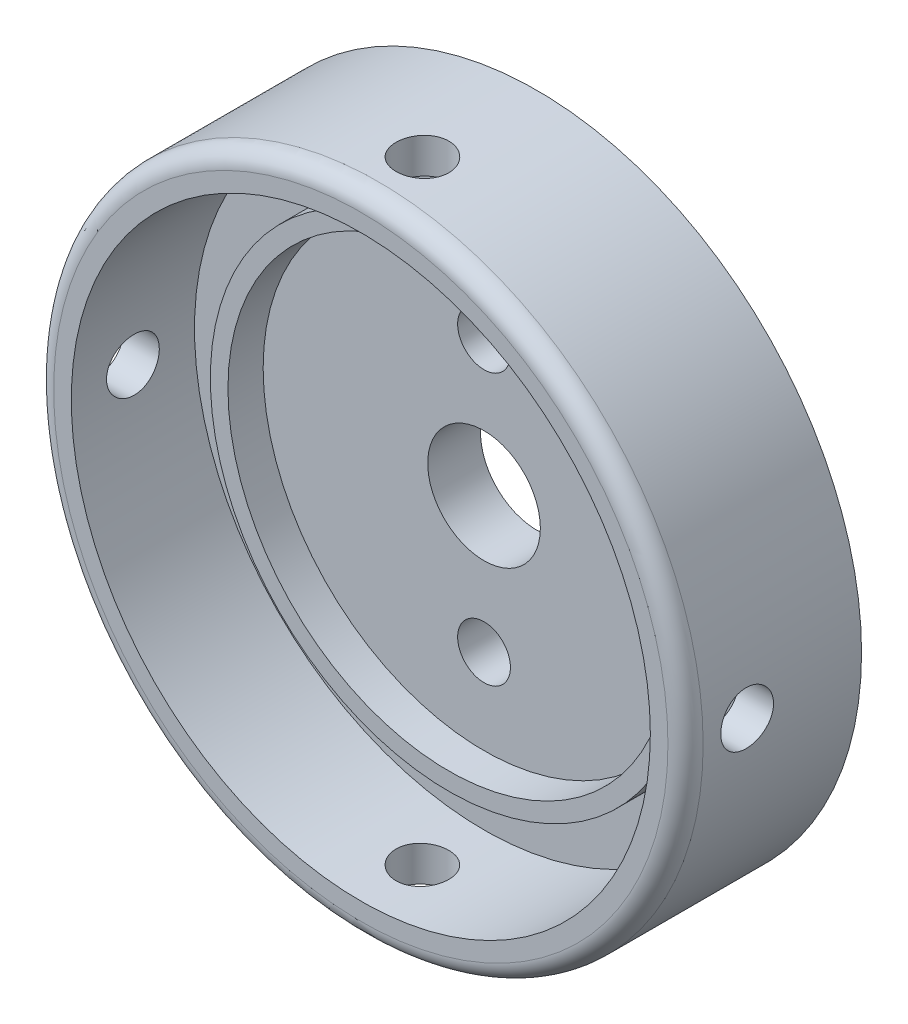
from build123d import *

# Parameters (mm, degrees)
ESQUISSE1_R                  = 18.45
ESQUISSE1_R_2                = 1.5
ESQUISSE1_R_3                = 3.2
BOSS_EXTRU_2_DEPTH           = 3
ESQUISSE1_13_R               = 18.45
ESQUISSE1_13_R_2             = 16.45
BOSS_EXTRU_4_DEPTH           = 10
ESQUISSE1_14_R               = 13.55
ESQUISSE1_14_R_2             = 12.55
BOSS_EXTRU_5_DEPTH           = 5
ENL_V_MAT_EXTRU_1_DEPTH      = 28.942888183
ENL_V_MAT_EXTRU_1_DEPTH_BACK = 28.942888183
ESQUISSE2_R                  = 1.5
ENL_V_MAT_EXTRU_2_DEPTH      = 28.942888353
ENL_V_MAT_EXTRU_2_DEPTH_BACK = 28.942888353
ESQUISSE3_R                  = 1.5
CONG_1_R                     = 1


with BuildPart() as part:
    # Esquisse1 → Boss.-Extru.2 (new body)
    with BuildSketch(Plane.XY):
        Circle(ESQUISSE1_R)
        with Locations((0, 7.7)):
            Circle(ESQUISSE1_R_2, mode=Mode.SUBTRACT)
        with Locations((0, -7.7)):
            Circle(ESQUISSE1_R_2, mode=Mode.SUBTRACT)
        Circle(ESQUISSE1_R_3, mode=Mode.SUBTRACT)
    extrude(amount=BOSS_EXTRU_2_DEPTH)

    # Esquisse1<13> → Boss.-Extru.4 (add)
    with BuildSketch(Plane.XY):
        Circle(ESQUISSE1_13_R)
        Circle(ESQUISSE1_13_R_2, mode=Mode.SUBTRACT)
    extrude(amount=BOSS_EXTRU_4_DEPTH)

    # Esquisse1<14> → Boss.-Extru.5 (add)
    with BuildSketch(Plane.XY):
        Circle(ESQUISSE1_14_R)
        Circle(ESQUISSE1_14_R_2, mode=Mode.SUBTRACT)
    extrude(amount=BOSS_EXTRU_5_DEPTH)

    # Esquisse2 → Enlèv. mat.-Extru.1 (cut, two sides: drawn at the far end of the back side and taken through both)
    with BuildSketch(Plane(origin=(0, 0, 0), x_dir=(0, 0, -1), z_dir=(1, 0, 0)).offset(-ENL_V_MAT_EXTRU_1_DEPTH_BACK)):
        with Locations((-6.5, 0)):
            Circle(ESQUISSE2_R)
    extrude(amount=ENL_V_MAT_EXTRU_1_DEPTH + ENL_V_MAT_EXTRU_1_DEPTH_BACK, mode=Mode.SUBTRACT)

    # Esquisse3 → Enlèv. mat.-Extru.2 (cut, two sides: drawn at the far end of the back side and taken through both)
    with BuildSketch(Plane(origin=(0, 0, 0), x_dir=(1, 0, 0), z_dir=(0, 1, 0)).offset(-ENL_V_MAT_EXTRU_2_DEPTH_BACK)):
        with Locations((0, -6.5)):
            Circle(ESQUISSE3_R)
    extrude(amount=ENL_V_MAT_EXTRU_2_DEPTH + ENL_V_MAT_EXTRU_2_DEPTH_BACK, mode=Mode.SUBTRACT)

    # Congé1
    cong_1_edges = [part.edges().sort_by_distance(p)[0] for p in [
        (-18.45, 0, 10),
    ]]
    fillet(cong_1_edges, radius=CONG_1_R)


solid = part.part
